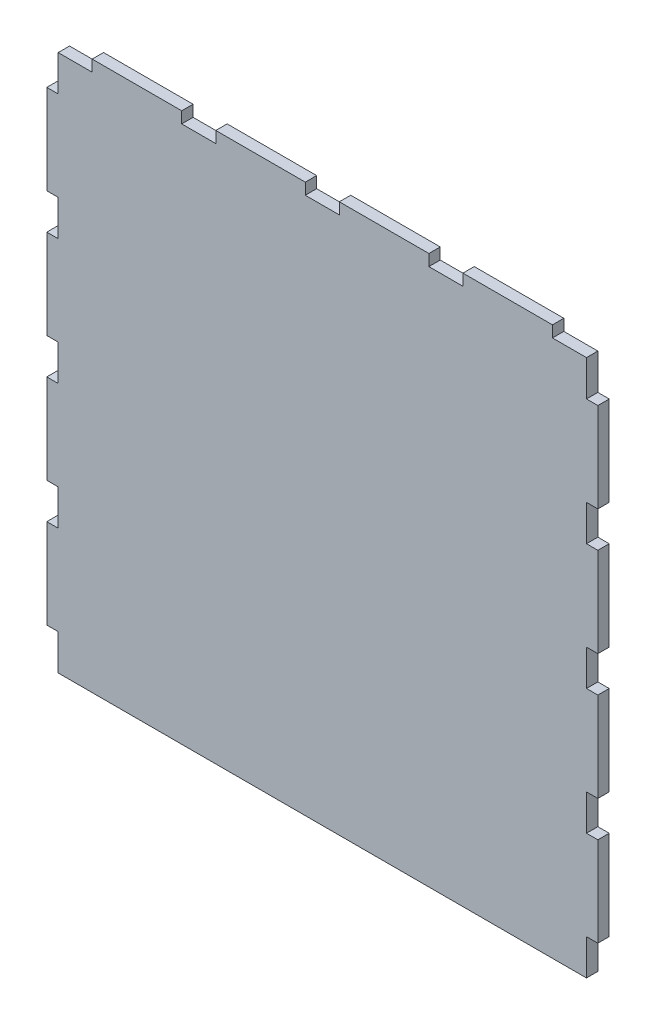
from build123d import *

# Parameters (mm, degrees)
BOSS_EXTRUDE1_DEPTH = 6.35


with BuildPart() as part:
    # Sketch2 → Boss-Extrude1 (new body)
    with BuildSketch(Plane.XY):
        Polygon((0, 0), (19, 0), (19, 6.35), (69, 6.35), (69, 0), (88, 0), (88, 6.35), (138, 6.35), (138, 0), (157, 0), (157, 6.35), (207, 6.35), (207, 0), (226, 0), (226, 6.35), (276, 6.35), (276, 0), (295, 0), (295, -20), (301.35, -20), (301.35, -70), (295, -70), (295, -90), (301.35, -90), (301.35, -140), (295, -140), (295, -160), (301.35, -160), (301.35, -210), (295, -210), (295, -230), (301.35, -230), (301.35, -280), (295, -280), (295, -300), (0, -300), (0, -280), (-6.35, -280), (-6.35, -230), (0, -230), (0, -210), (-6.35, -210), (-6.35, -160), (0, -160), (0, -140), (-6.35, -140), (-6.35, -90), (0, -90), (0, -70), (-6.35, -70), (-6.35, -20), (0, -20), align=None)
    extrude(amount=BOSS_EXTRUDE1_DEPTH)


solid = part.part
